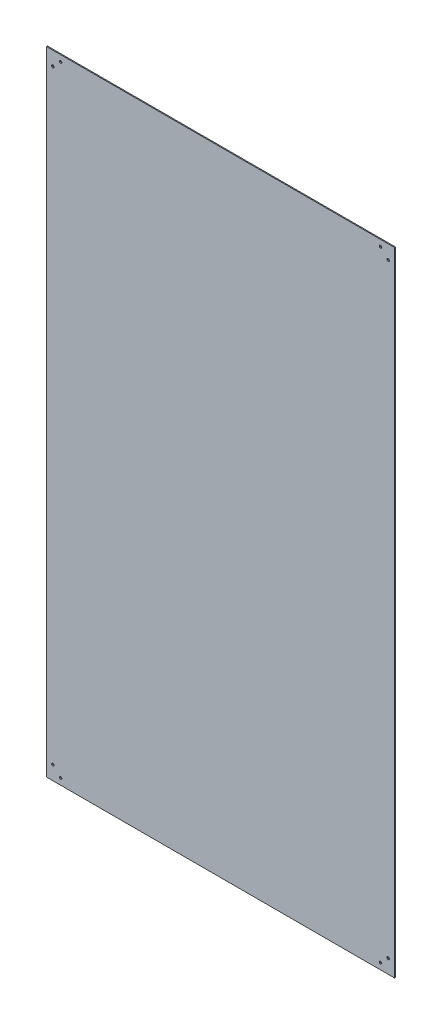
from build123d import *

# Parameters (mm, degrees)
SCHIZZO1_W               = 1100
SCHIZZO1_H               = 2000
BASE_FLANGIA1_DEPTH      = 3
SCHIZZO2_R               = 4
TAGLIO_ESTRUSIONE1_DEPTH = 1142.275164016


# Sheet-metal steps are written as plain solids
with BuildPart() as part:
    # Schizzo1 → Base-Flangia1 (new body)
    with BuildSketch(Plane.XY):
        Rectangle(SCHIZZO1_W, SCHIZZO1_H)
    extrude(amount=-BASE_FLANGIA1_DEPTH)

    # Schizzo2 → Taglio-Estrusione1 (cut, through all)
    with BuildSketch(Plane.XY):
        with Locations((-530, -955.75)):
            Circle(SCHIZZO2_R)
        with Locations(Location((530, -955.75, 0), (0, 0, 180))):
            Circle(SCHIZZO2_R)
        with Locations(Location((-530, 955.75, 0), (0, 0, 180))):
            Circle(SCHIZZO2_R)
        with Locations((530, 955.75)):
            Circle(SCHIZZO2_R)
        with Locations((-505.75, -980)):
            Circle(SCHIZZO2_R)
        with Locations(Location((505.75, -980, 0), (0, 0, 180))):
            Circle(SCHIZZO2_R)
        with Locations((505.75, 980)):
            Circle(SCHIZZO2_R)
        with Locations(Location((-505.75, 980, 0), (0, 0, 180))):
            Circle(SCHIZZO2_R)
    extrude(amount=-TAGLIO_ESTRUSIONE1_DEPTH, mode=Mode.SUBTRACT)


solid = part.part
